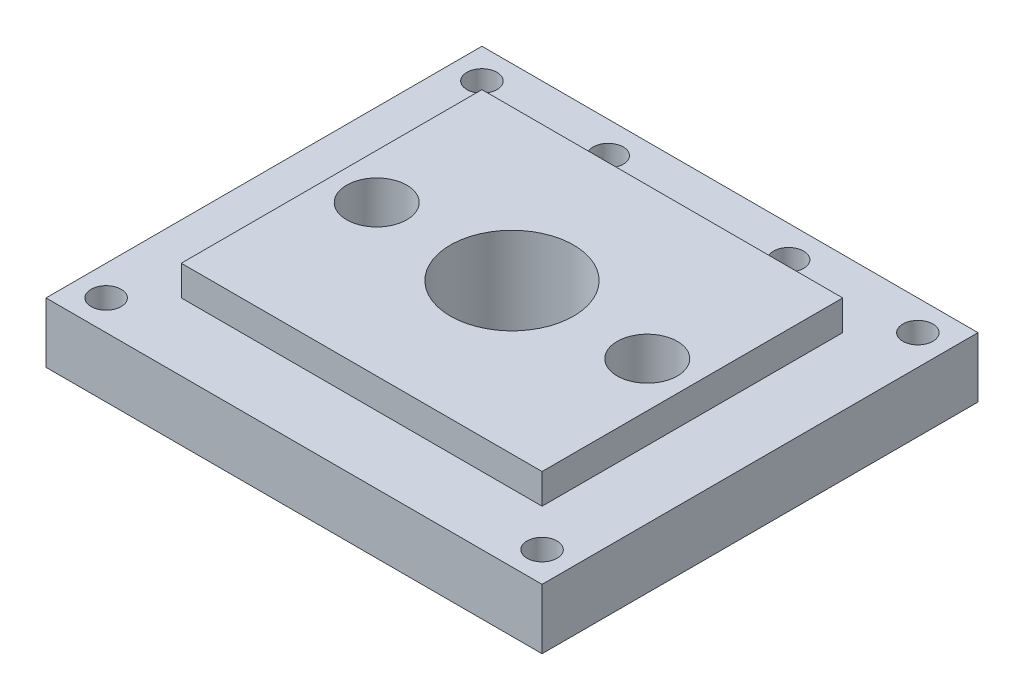
from build123d import *

# Parameters (mm, degrees)
SKETCH_1_W          = 16.5
SKETCH_1_H          = 14.5
EXTRUDE_1_DEPTH     = 2
SKETCH_2_W          = 12
SKETCH_2_H          = 10
EXTRUDE_2_DEPTH     = 1
SKETCH_3_R          = 0.5
CUT_EXTRUDE_1_DEPTH = 12.163556781
SKETCH_5_R          = 2.05
SKETCH_5_R_2        = 1
CUT_EXTRUDE_2_DEPTH = 12.385297537
SKETCH_6_R          = 0.75
CUT_EXTRUDE_3_DEPTH = 1
SKETCH_7_R          = 1.5
CUT_EXTRUDE_4_DEPTH = 1
FILLET_1_R          = 1
SKETCH_8_R          = 0.5
CUT_EXTRUDE_5_DEPTH = 12.163556781


with BuildPart() as part:
    # 草图1 → 凸台-拉伸1 (new body)
    with BuildSketch(Plane(origin=(0, 0, 0), x_dir=(1, 0, 0), z_dir=(0, 1, 0))):
        Rectangle(SKETCH_1_W, SKETCH_1_H)
    extrude(amount=EXTRUDE_1_DEPTH)

    # 草图2 → 凸台-拉伸2 (add)
    with BuildSketch(Plane(origin=(0, 2, 0), x_dir=(1, 0, 0), z_dir=(0, 1, 0))):
        Rectangle(SKETCH_2_W, SKETCH_2_H)
    extrude(amount=EXTRUDE_2_DEPTH)

    # 草图3 → 切除-拉伸1 (cut, through all)
    with BuildSketch(Plane(origin=(0, 2, 0), x_dir=(1, 0, 0), z_dir=(0, 1, 0))):
        with Locations(Location((-7.25, 6.25, 0), (0, 0, 270))):
            Circle(SKETCH_3_R)
        with Locations(Location((7.25, 6.25, 0), (0, 0, 90))):
            Circle(SKETCH_3_R)
        with Locations(Location((7.25, -6.25, 0), (0, 0, 270))):
            Circle(SKETCH_3_R)
        with Locations(Location((-7.25, -6.25, 0), (0, 0, 90))):
            Circle(SKETCH_3_R)
    extrude(amount=-CUT_EXTRUDE_1_DEPTH, mode=Mode.SUBTRACT)

    # 草图5 → 切除-拉伸2 (cut, through all)
    with BuildSketch(Plane(origin=(0, 3, 0), x_dir=(1, 0, 0), z_dir=(0, 1, 0))):
        with Locations(Location((0, 0, 0), (0, 0, 270))):
            Circle(SKETCH_5_R)
        with Locations(Location((-4.5, 0, 0), (0, 0, 270))):
            Circle(SKETCH_5_R_2)
        with Locations(Location((4.5, 0, 0), (0, 0, 90))):
            Circle(SKETCH_5_R_2)
    extrude(amount=-CUT_EXTRUDE_2_DEPTH, mode=Mode.SUBTRACT)

    # 草图6 → 切除-拉伸3 (cut)
    with BuildSketch(Plane.XZ):
        with Locations(Location((7.25, -6.25, 0), (0, 0, 270))):
            Circle(SKETCH_6_R)
        with Locations(Location((-7.25, -6.25, 0), (0, 0, 270))):
            Circle(SKETCH_6_R)
        with Locations(Location((7.25, 6.25, 0), (0, 0, 270))):
            Circle(SKETCH_6_R)
        with Locations(Location((-7.25, 6.25, 0), (0, 0, 270))):
            Circle(SKETCH_6_R)
    extrude(amount=-CUT_EXTRUDE_3_DEPTH, mode=Mode.SUBTRACT)

    # 草图7 → 切除-拉伸4 (cut)
    with BuildSketch(Plane.XZ):
        with Locations(Location((-4.5, 0, 0), (0, 0, 270))):
            Circle(SKETCH_7_R)
        with Locations(Location((4.5, 0, 0), (0, 0, 270))):
            Circle(SKETCH_7_R)
    extrude(amount=-CUT_EXTRUDE_4_DEPTH, mode=Mode.SUBTRACT)

    # 圆角1
    # the kernel refuses this fillet: 1 mm, written as the material it adds along each edge
    with BuildSketch(Plane(origin=(-4.5, 1, 0), x_dir=(0, 0, -1), z_dir=(-1, 0, 0))) as fillet_1_piece_1_section:
        with BuildLine():
            CenterArc((0.5, 0.866025404), FILLET_1_R, 300, 60)
            Line((1, 0), (1.01, -0.017320508))
            ThreePointArc((1.01, -0.017320508), (1.25, -0.02), (1.5, -0.02))
            Line((1.5, -0.02), (1.52, 0))
            Line((1.52, 0), (1.52, 0.866025404))
            Line((1.52, 0.866025404), (1.5, 0.866025404))
        make_face()
    fillet_1_piece_1 = revolve(axis=Axis((-4.5, 1, 0), (0, -1, 0)), mode=Mode.PRIVATE)
    fillet_1_piece_1 = fillet_1_piece_1 - Plane(origin=(-4.5, 0.639457319, 0), x_dir=(0, 0, 1), z_dir=(0, 1, 0)) * Cylinder(1, 7, mode=Mode.PRIVATE)
    add(fillet_1_piece_1)
    with BuildSketch(Plane(origin=(4.5, 1, 0), x_dir=(0, 0, -1), z_dir=(-1, 0, 0))) as fillet_1_piece_2:
        with BuildLine():
            CenterArc((0.5, 0.866025404), FILLET_1_R, 300, 60)
            Line((1, 0), (1.01, -0.017320508))
            ThreePointArc((1.01, -0.017320508), (1.25, -0.02), (1.5, -0.02))
            Line((1.5, -0.02), (1.52, 0))
            Line((1.52, 0), (1.52, 0.866025404))
            Line((1.52, 0.866025404), (1.5, 0.866025404))
        make_face()
    revolve(axis=Axis((4.5, 1, 0), (0, -1, 0)))

    # 草图8 → 切除-拉伸5 (cut, through all)
    with BuildSketch(Plane(origin=(0, 2, 0), x_dir=(1, 0, 0), z_dir=(0, 1, 0))):
        with Locations(Location((-3, 6.2, 0), (0, 0, 270))):
            Circle(SKETCH_8_R)
        with Locations(Location((3, 6.2, 0), (0, 0, 90))):
            Circle(SKETCH_8_R)
    extrude(amount=-CUT_EXTRUDE_5_DEPTH, mode=Mode.SUBTRACT)


solid = part.part
